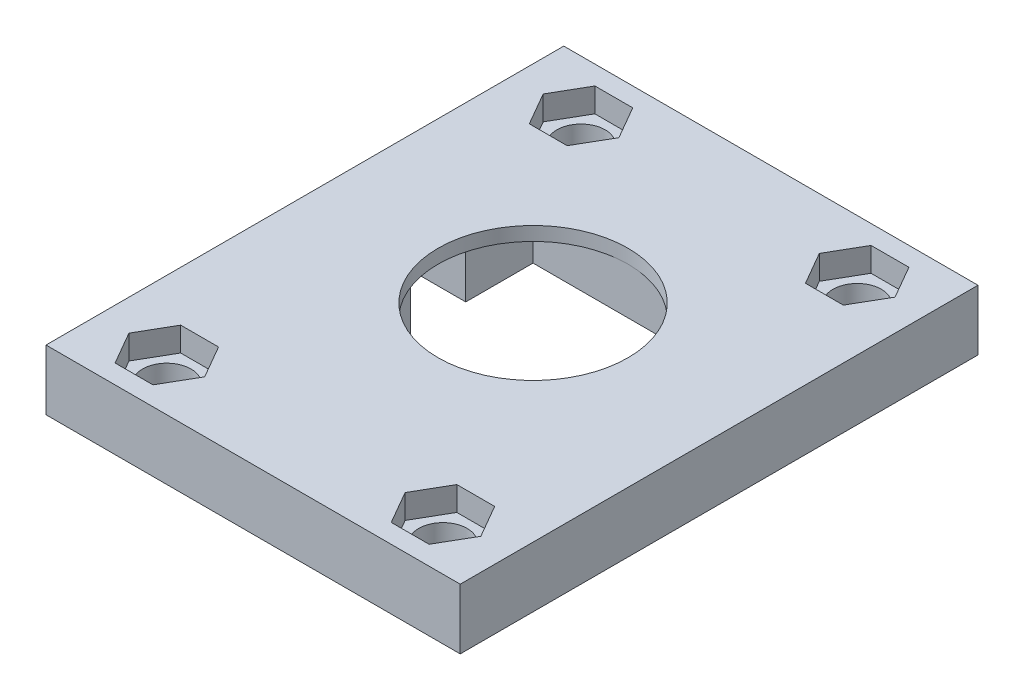
from build123d import *

# Parameters (mm, degrees)
SKETCH1_W           = 30.48
SKETCH1_H           = 38.1
SKETCH1_R           = 1.778
BOSS_EXTRUDE1_DEPTH = 4.445
SKETCH2_R           = 1.778
SKETCH2_R_2         = 6.985
CUT_EXTRUDE1_DEPTH  = 25.797542721
CUT_EXTRUDE2_DEPTH  = 3.429
CUT_EXTRUDE3_DEPTH  = 1.778


with BuildPart() as part:
    # Sketch1 → Boss-Extrude1 (new body)
    with BuildSketch(Plane(origin=(0, 0, 0), x_dir=(1, 0, 0), z_dir=(0, 1, 0))):
        Rectangle(SKETCH1_W, SKETCH1_H)
        with Locations((-10.16, 15.24)):
            Circle(SKETCH1_R, mode=Mode.SUBTRACT)
        with Locations((10.16, 15.24)):
            Circle(SKETCH1_R, mode=Mode.SUBTRACT)
        with Locations((-10.16, -15.24)):
            Circle(SKETCH1_R, mode=Mode.SUBTRACT)
        with Locations((10.16, -15.24)):
            Circle(SKETCH1_R, mode=Mode.SUBTRACT)
    extrude(amount=BOSS_EXTRUDE1_DEPTH)

    # Sketch2 → Cut-Extrude1 (cut, through all)
    with BuildSketch(Plane.XZ):
        with Locations((-10.16, -15.24)):
            Circle(SKETCH2_R)
        with Locations((10.16, -15.24)):
            Circle(SKETCH2_R)
        with Locations((10.16, 15.24)):
            Circle(SKETCH2_R)
        with Locations((-10.16, 15.24)):
            Circle(SKETCH2_R)
        with Locations((0, -1.5494)):
            Circle(SKETCH2_R_2)
    extrude(amount=-CUT_EXTRUDE1_DEPTH, mode=Mode.SUBTRACT)

    # Sketch3 → Cut-Extrude2 (cut)
    with BuildSketch(Plane.XZ):
        with BuildLine():
            Line((-6.985, -3.5814), (-6.985, -8.5344))
            Line((-6.985, -8.5344), (0, -8.5344))
            ThreePointArc((0, -8.5344), (-6.985, -1.549399996), (9e-09, 5.4356))
            Line((9e-09, 5.4356), (-6.985, 5.4356))
            Line((-6.985, 5.4356), (-6.985, 0.4826))
            Line((-6.985, 0.4826), (-11.049, 0.4826))
            Line((-11.049, 0.4826), (-11.049, -3.5814))
            Line((-11.049, -3.5814), (-6.985, -3.5814))
        make_face()
        with BuildLine():
            Line((0, -8.5344), (6.985, -8.5344))
            Line((6.985, -8.5344), (6.985, -3.5814))
            Line((6.985, -3.5814), (11.049, -3.5814))
            Line((11.049, -3.5814), (11.049, 0.4826))
            Line((11.049, 0.4826), (6.985, 0.4826))
            Line((6.985, 0.4826), (6.985, 5.4356))
            Line((6.985, 5.4356), (9e-09, 5.4356))
            ThreePointArc((9e-09, 5.4356), (6.985, -1.549400004), (0, -8.5344))
        make_face()
    extrude(amount=-CUT_EXTRUDE2_DEPTH, mode=Mode.SUBTRACT)

    # Sketch4 → Cut-Extrude3 (cut)
    with BuildSketch(Plane(origin=(0, 4.445, 0), x_dir=(1, 0, 0), z_dir=(0, 1, 0))):
        Polygon((-7.373707601, 15.24), (-8.7668538, 17.653), (-11.5531462, 17.653), (-12.946292399, 15.24), (-11.5531462, 12.827), (-8.7668538, 12.827), align=None)
        Polygon((8.7668538, 12.827), (7.373707601, 15.24), (8.7668538, 17.653), (11.5531462, 17.653), (12.946292399, 15.24), (11.5531462, 12.827), align=None)
        Polygon((11.5531462, -12.827), (8.7668538, -12.827), (7.373707601, -15.24), (8.7668538, -17.653), (11.5531462, -17.653), (12.946292399, -15.24), align=None)
        Polygon((-8.7668538, -12.827), (-7.373707601, -15.24), (-8.7668538, -17.653), (-11.5531462, -17.653), (-12.946292399, -15.24), (-11.5531462, -12.827), align=None)
    extrude(amount=-CUT_EXTRUDE3_DEPTH, mode=Mode.SUBTRACT)


solid = part.part
